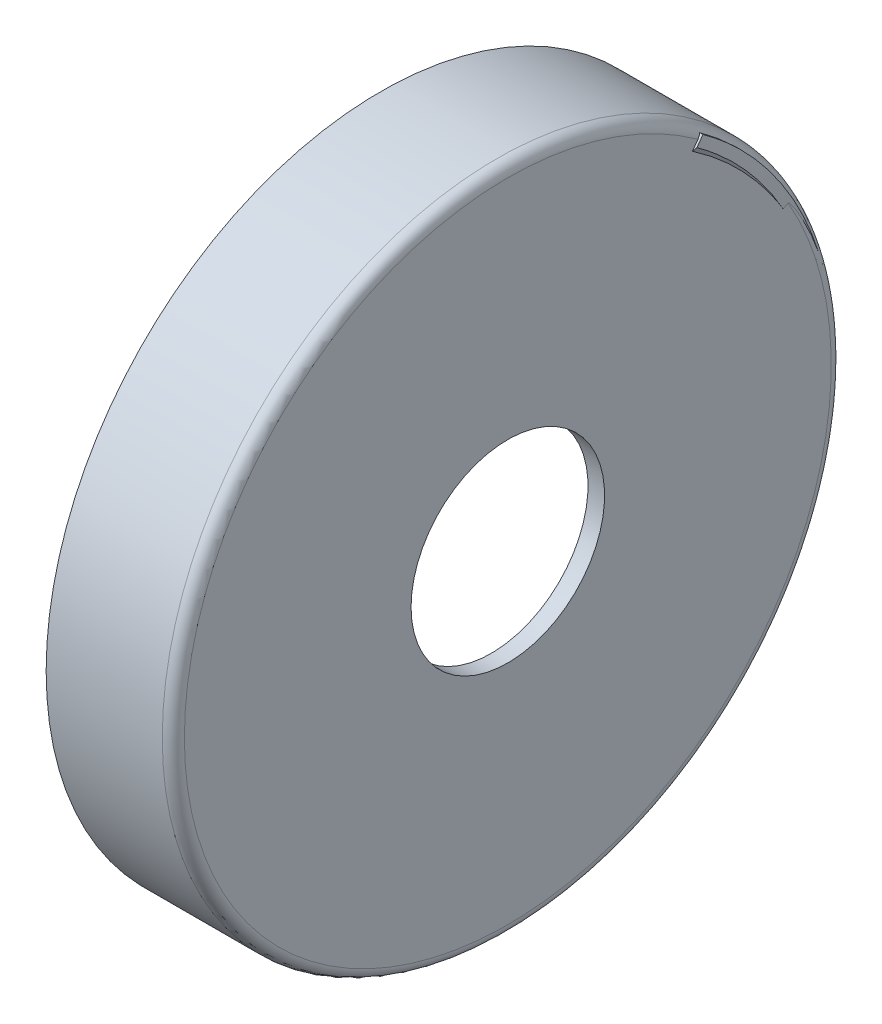
from build123d import *

# Parameters (mm, degrees)
SWEEP1_PITCH       = 6
SKETCH4_R          = 60.5
CUT_EXTRUDE1_DEPTH = 89.702085688


with BuildPart() as part:
    # Sketch1 → Revolve1 (revolve)
    with BuildSketch(Plane.XY, mode=Mode.PRIVATE) as revolve1_sk:
        with BuildLine():
            Line((0, 60.5), (21, 60.5))
            ThreePointArc((21, 60.5), (22.414213562, 59.914213562), (23, 58.5))
            Line((23, 58.5), (23, 17.5))
            Line((23, 17.5), (20, 17.5))
            Line((20, 17.5), (20, 55.5))
            ThreePointArc((20, 55.5), (19.414213562, 56.914213562), (18, 57.5))
            Line((18, 57.5), (0, 57.5))
            Line((0, 57.5), (0, 60.5))
        make_face()
    revolve(revolve1_sk.sketch.rotate(Axis((0, 0, 0), (1, 0, 0)), 90), axis=Axis((0, 0, 0), (1, 0, 0)))

    # Sweep1: arcs per turn and ends read off the stored shape
    # Sweep1: the profile of Sketch3 screwed along a right-hand helix through 3.900003 turns, 14 arcs to a turn; built about Z, then put on its axis
    sweep1_z = Axis((0, 0, 0), (0, 0, 1))
    sweep1_corners = [(-57.499999991, 0.001033671, -1.7167e-05), (-53.777052649, 0.000966744, -2.149461817), (-53.777052649, 0.000966744, -3.650572517), (-57.499999991, 0.001033671, -5.800017167), (-59.365618697, 0.001067209, -5.800017167), (-59.365618697, 0.001067209, -1.7167e-05)]
    with BuildLine(mode=Mode.PRIVATE) as sweep1_profile:
        Line(sweep1_corners[0], sweep1_corners[1])
        Line(sweep1_corners[1], sweep1_corners[2])
        Line(sweep1_corners[2], sweep1_corners[3])
        Line(sweep1_corners[3], sweep1_corners[4])
        Line(sweep1_corners[4], sweep1_corners[5])
        Line(sweep1_corners[5], sweep1_corners[0])
    sweep1_cap = Face(sweep1_profile.wire())
    sweep1_turn_angles = [0, 12.857142857, 25.714285714, 38.571428571, 51.428571429, 64.285714286, 77.142857143, 90, 102.857142857, 115.714285714, 128.571428571, 141.428571429, 154.285714286, 167.142857143, 180, 192.857142857, 205.714285714, 218.571428571, 231.428571429, 244.285714286, 257.142857143, 270, 282.857142857, 295.714285714, 308.571428571, 321.428571429, 334.285714286, 347.142857143, 360]
    sweep1_turn_weights = [1, 0.9749279121818236, 1, 0.9749279121818236, 1, 0.9749279121818236, 1, 0.9749279121818236, 1, 0.9749279121818236, 1, 0.9749279121818236, 1, 0.9749279121818236, 1, 0.9749279121818236, 1, 0.9749279121818236, 1, 0.9749279121818236, 1, 0.9749279121818236, 1, 0.9749279121818237, 1, 0.9749279121818236, 1, 0.9749279121818236, 1]
    sweep1_turn_rails = [Edge.make_bspline([Vector(p[0], p[1], 0).rotate(sweep1_z, sweep1_turn_angles[k]) / sweep1_turn_weights[k] + Vector(0, 0, p[2] + SWEEP1_PITCH * sweep1_turn_angles[k] / 360) for k in range(29)], [0, 0, 0, 1, 1, 2, 2, 3, 3, 4, 4, 5, 5, 6, 6, 7, 7, 8, 8, 9, 9, 10, 10, 11, 11, 12, 12, 13, 13, 14, 14, 14], 2, sweep1_turn_weights) for p in sweep1_corners]
    sweep1_turn_sides = [Face.make_surface_from_curves(sweep1_turn_rails[p[0]], sweep1_turn_rails[p[1]]) for p in [(0, 1), (1, 2), (2, 3), (3, 4), (4, 5), (5, 0)]]
    sweep1_last_angles = [1080, 1092.857142857, 1105.714285714, 1118.571428571, 1131.428571429, 1144.285714286, 1157.142857143, 1170, 1182.857142857, 1195.714285714, 1208.571428571, 1221.428571429, 1234.285714286, 1247.142857143, 1260, 1272.857142857, 1285.714285714, 1298.571428571, 1311.428571429, 1324.285714286, 1337.142857143, 1350, 1362.857142857, 1375.714285714, 1388.571428571, 1396.286214286, 1404.001]
    sweep1_last_weights = [1, 0.9749279121818235, 1, 0.974927912181824, 1, 0.9749279121818235, 1, 0.9749279121818235, 1, 0.9749279121818235, 1, 0.974927912181824, 1, 0.9749279121818235, 1, 0.9749279121818235, 1, 0.9749279121818235, 1, 0.974927912181824, 1, 0.9749279121818235, 1, 0.974927912181824, 1, 0.990948590323975, 1]
    sweep1_last_rails = [Edge.make_bspline([Vector(p[0], p[1], 0).rotate(sweep1_z, sweep1_last_angles[k]) / sweep1_last_weights[k] + Vector(0, 0, p[2] + SWEEP1_PITCH * sweep1_last_angles[k] / 360) for k in range(27)], [0, 0, 0, 1, 1, 2, 2, 3, 3, 4, 4, 5, 5, 6, 6, 7, 7, 8, 8, 9, 9, 10, 10, 11, 11, 12, 12, 13, 13, 13], 2, sweep1_last_weights) for p in sweep1_corners]
    sweep1_last_sides = [Face.make_surface_from_curves(sweep1_last_rails[p[0]], sweep1_last_rails[p[1]]) for p in [(0, 1), (1, 2), (2, 3), (3, 4), (4, 5), (5, 0)]]
    sweep1 = Plane(origin=(0, 0, 0), x_dir=(0, -1, 0), z_dir=(1, 0, 0)) * Solid(Shell([*[p.moved(Location((0, 0, SWEEP1_PITCH * i))) for i in range(3) for p in sweep1_turn_sides], *sweep1_last_sides, sweep1_cap, sweep1_cap.rotate(sweep1_z, 1404.001).moved(Location((0, 0, SWEEP1_PITCH * 1404.001 / 360)))]))
    add(sweep1)

    # Sketch4 → Cut-Extrude1 (cut, through all)
    with BuildSketch(Plane.ZY):
        Circle(SKETCH4_R)
    extrude(amount=CUT_EXTRUDE1_DEPTH, mode=Mode.SUBTRACT)


solid = part.part
